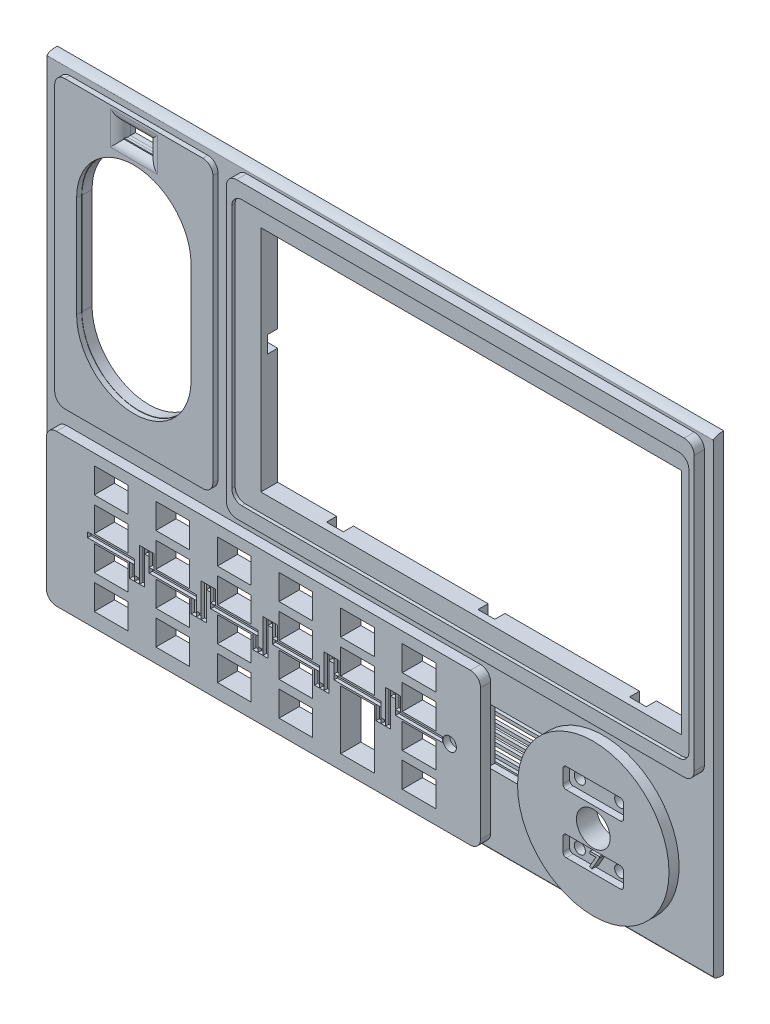
from build123d import *

# Parameters (mm, degrees)
SKETCH1_W                   = 198
SKETCH1_H                   = 140
MAIN_BODY_DEPTH             = 3
LONG_CORNERS_SIZE           = 3
LONG_CORNERS_SIZE_2         = 1
SKETCH2_W                   = 47
SKETCH2_H                   = 85
SPEAKER_DEPTH               = 1.5
SPEAKER_CORNERS_R           = 3
SPEAKER_CUT_DEPTH           = 122.331158548
SKETCH21_W                  = 43
SKETCH21_H                  = 72
SPEAKER_SLOT_DEPTH          = 3
SKETCH36_W                  = 43
SKETCH36_H                  = 0.5
SKETCH36_W_2                = 5.5
SKETCH36_W_3                = 3.5
SKETCH36_W_4                = 10
SPEAKER_PRINT_SUPPORT_DEPTH = 3
SKETCH3_W                   = 139
SKETCH3_H                   = 87.25
LCD_DEPTH                   = 3
LCD_CORNERS_R               = 3
SKETCH9_W                   = 135.8
SKETCH9_H                   = 78.75
LCD_FRONT_DEPTH             = 1
LCD_FRONT_CORNERS_R         = 3
SKETCH10_W                  = 125
SKETCH10_H                  = 68
LCD_BACK_DEPTH              = 122.396046203
SKETCH56_W                  = 5
SKETCH56_H                  = 3
SKETCH56_W_2                = 3
SKETCH56_H_2                = 5
LCD_GLUE_POINTS_DEPTH       = 3
SKETCH4_W                   = 129
SKETCH4_H                   = 45
KEYPAD_DEPTH                = 3
KEYPAD_CORNERS_R            = 3
SKETCH25_W                  = 10
SKETCH25_H                  = 7.5
SKETCH25_H_2                = 17.5
KEYPAD_CUTS_0_8_DEPTH       = 122.396046208
SKETCH5_R                   = 22.5
VFO_DEPTH                   = 3
SKETCH7_R                   = 5
VFO_ENCODER_KNOB_CUT_DEPTH  = 122.396046208
SKETCH37_W                  = 18
SKETCH37_H                  = 6
LOGO_CUT_DEPTH              = 2
SKETCH44_R                  = 1.65
ENCODER_MOUNT_HOLES_DEPTH   = 122.396046208
ENC_CUT_CORNERS_R           = 1
LOGO_TXT_VER_DEPTH          = 2
ESP32_W                     = 18.5
ESP32_H                     = 16.5
ESP32_CAN_CUT_DEPTH         = 3
SKETCH43_W                  = 17.5
SKETCH43_H                  = 17.5
LORA_CUT_DEPTH              = 2.5
SKETCH47_W                  = 27
SKETCH47_H                  = 18.5
ESP32_EX_CUT_DEPTH          = 1
SKETCH49_W                  = 8
SKETCH49_H                  = 4
AMB_SENSOR_DEPTH            = 122.396046203
AMB_CORNERS_R               = 3
SKETCH50_W                  = 14
SKETCH50_H                  = 1.5
SKETCH50_W_2                = 1.5
SKETCH50_H_2                = 4.24
SKETCH50_H_3                = 10
SKETCH50_W_3                = 1.3
SKETCH50_W_4                = 1.45
SKETCH50_W_5                = 1.26
SKETCH50_W_6                = 1.46
LORA_ANT_DEPTH              = 1
SKETCH51_R                  = 0.5
LORA_ANT_PIN_DEPTH          = 122.396046208
SKETCH52_R                  = 2
LORA_ANT_SOLDER_DEPTH       = 2
SKETCH53_W                  = 26.5
SKETCH53_H                  = 1
ESP32_SUPPORT_DEPTH         = 1
SKETCH54_W                  = 17.5
SKETCH54_H                  = 0.8
LORA_SUPPORTS_DEPTH         = 2.5
SKETCH55_W                  = 10
SKETCH55_H                  = 20
SKETCH55_W_2                = 22
SKETCH55_H_2                = 4
SKETCH55_W_3                = 4
SKETCH55_H_3                = 10
SKETCH55_W_4                = 3
SKETCH55_H_4                = 5
SKETCH55_W_5                = 14
SKETCH55_W_6                = 13
SKETCH55_H_5                = 3
SKETCH55_W_7                = 15
SKETCH55_H_6                = 6
CONN_CUTOUTS_DEPTH          = 2


with BuildPart() as part:
    # Sketch1 → main_body (new body)
    with BuildSketch(Plane.XY):
        Rectangle(SKETCH1_W, SKETCH1_H)
    extrude(amount=MAIN_BODY_DEPTH)

    # long_corners
    # an asymmetric fillet: 3, 1 mm, written as the material it takes off along each edge
    with BuildSketch(Plane(origin=(-106.5, 70, 3), x_dir=(0, 0, -1), z_dir=(1, 0, 0)), Plane(origin=(106.5, -70, 3), x_dir=(0, 0, -1), z_dir=(-1, 0, 0))) as long_corners_piece_1:
        with BuildLine():
            Bezier((LONG_CORNERS_SIZE, 0), (0, 0), (0, -LONG_CORNERS_SIZE_2), weights=[1, 0.707106781, 1])
            Line((0, -LONG_CORNERS_SIZE_2), (0, 0))
            Line((0, 0), (LONG_CORNERS_SIZE, 0))
        make_face()
    extrude(amount=213, mode=Mode.SUBTRACT)

    # Sketch2 → speaker (add)
    with BuildSketch(Plane.XY.offset(3)):
        with Locations((-71.75, 24.75)):
            Rectangle(SKETCH2_W, SKETCH2_H)
    extrude(amount=SPEAKER_DEPTH)

    # speaker_corners
    speaker_corners_edges = [part.edges().sort_by_distance(p)[0] for p in [
        (-95.25, 67.25, 3.75),
        (-95.25, -17.75, 3.75),
        (-48.25, -17.75, 3.75),
        (-48.25, 67.25, 3.75),
    ]]
    fillet(speaker_corners_edges, radius=SPEAKER_CORNERS_R)

    # Sketch19 → speaker_cut (cut, through all)
    with BuildSketch(Plane.XY.offset(4.5)):
        with BuildLine():
            Line((-88.75, 8.25), (-88.75, 38.25))
            ThreePointArc((-88.75, 38.25), (-71.75, 55.25), (-54.75, 38.25))
            Line((-54.75, 38.25), (-54.75, 8.25))
            ThreePointArc((-54.75, 8.25), (-71.75, -8.75), (-88.75, 8.25))
        make_face()
    extrude(amount=-SPEAKER_CUT_DEPTH, mode=Mode.SUBTRACT)

    # Sketch21 → speaker_slot (cut)
    with BuildSketch(Plane(origin=(0, 0, 0), x_dir=(-1, 0, 0), z_dir=(0, 0, -1))):
        with Locations((71.75, 23.25)):
            Rectangle(SKETCH21_W, SKETCH21_H)
    extrude(amount=-SPEAKER_SLOT_DEPTH, mode=Mode.SUBTRACT)

    # Sketch36 → speaker_print_support (add)
    # profile 1 of 17: a face of its own
    with BuildSketch(Plane(origin=(0, 0, 3), x_dir=(-1, 0, 0), z_dir=(0, 0, -1))):
        with BuildLine():
            Line((54.25, 8.263862744), (54.25, 38.236137256))
            ThreePointArc((54.25, 38.236137256), (71.75, 55.736137256), (89.25, 38.236137256))
            Line((89.25, 38.236137256), (89.25, 8.263862744))
            ThreePointArc((89.25, 8.263862744), (71.75, -9.236137256), (54.25, 8.263862744))
        make_face()
        with BuildLine():
            Line((54.831583339, 8.263862744), (54.831583339, 38.236137256))
            ThreePointArc((54.831583339, 38.236137256), (71.75, 55.154553916), (88.668416661, 38.236137256))
            Line((88.668416661, 38.236137256), (88.668416661, 8.263862744))
            ThreePointArc((88.668416661, 8.263862744), (71.75, -8.654553916), (54.831583339, 8.263862744))
        make_face(mode=Mode.SUBTRACT)
    # profile 2 of 17: a face of its own
    with BuildSketch(Plane(origin=(0, 0, 3), x_dir=(-1, 0, 0), z_dir=(0, 0, -1))):
        with Locations((71.75, 57)):
            Rectangle(SKETCH36_W, SKETCH36_H)
    # profile 3 of 17: a face of its own
    with BuildSketch(Plane(origin=(0, 0, 3), x_dir=(-1, 0, 0), z_dir=(0, 0, -1))):
        with Locations((90.5, 0)):
            Rectangle(SKETCH36_W_2, SKETCH36_H)
    # profile 4 of 17: a face of its own
    with BuildSketch(Plane(origin=(0, 0, 3), x_dir=(-1, 0, 0), z_dir=(0, 0, -1))):
        with Locations((71.75, -10.5)):
            Rectangle(SKETCH36_W, SKETCH36_H)
    # profile 5 of 17: a face of its own
    with BuildSketch(Plane(origin=(0, 0, 3), x_dir=(-1, 0, 0), z_dir=(0, 0, -1))):
        with Locations((90.5, 46.5)):
            Rectangle(SKETCH36_W_2, SKETCH36_H)
    # profile 6 of 17: a face of its own
    with BuildSketch(Plane(origin=(0, 0, 3), x_dir=(-1, 0, 0), z_dir=(0, 0, -1))):
        with Locations((91.5, 35)):
            Rectangle(SKETCH36_W_3, SKETCH36_H)
    # profile 7 of 17: a face of its own
    with BuildSketch(Plane(origin=(0, 0, 3), x_dir=(-1, 0, 0), z_dir=(0, 0, -1))):
        with Locations((91.5, 23.5)):
            Rectangle(SKETCH36_W_3, SKETCH36_H)
    # profile 8 of 17: a face of its own
    with BuildSketch(Plane(origin=(0, 0, 3), x_dir=(-1, 0, 0), z_dir=(0, 0, -1))):
        with Locations((91.5, 11)):
            Rectangle(SKETCH36_W_3, SKETCH36_H)
    # profile 9 of 17: a face of its own
    with BuildSketch(Plane(origin=(0, 0, 3), x_dir=(-1, 0, 0), z_dir=(0, 0, -1))):
        with Locations((88.25, -5.5)):
            Rectangle(SKETCH36_W_4, SKETCH36_H)
    # profile 10 of 17: a face of its own
    with BuildSketch(Plane(origin=(0, 0, 3), x_dir=(-1, 0, 0), z_dir=(0, 0, -1))):
        with Locations((88.25, 52)):
            Rectangle(SKETCH36_W_4, SKETCH36_H)
    # profile 11 of 17: a face of its own
    with BuildSketch(Plane(origin=(0, 0, 3), x_dir=(-1, 0, 0), z_dir=(0, 0, -1))):
        with Locations((55.25, 52)):
            Rectangle(SKETCH36_W_4, SKETCH36_H)
    # profile 12 of 17: a face of its own
    with BuildSketch(Plane(origin=(0, 0, 3), x_dir=(-1, 0, 0), z_dir=(0, 0, -1))):
        with Locations((53, 46.5)):
            Rectangle(SKETCH36_W_2, SKETCH36_H)
    # profile 13 of 17: a face of its own
    with BuildSketch(Plane(origin=(0, 0, 3), x_dir=(-1, 0, 0), z_dir=(0, 0, -1))):
        with Locations((52, 35)):
            Rectangle(SKETCH36_W_3, SKETCH36_H)
    # profile 14 of 17: a face of its own
    with BuildSketch(Plane(origin=(0, 0, 3), x_dir=(-1, 0, 0), z_dir=(0, 0, -1))):
        with Locations((52, 23.5)):
            Rectangle(SKETCH36_W_3, SKETCH36_H)
    # profile 15 of 17: a face of its own
    with BuildSketch(Plane(origin=(0, 0, 3), x_dir=(-1, 0, 0), z_dir=(0, 0, -1))):
        with Locations((52, 10.5)):
            Rectangle(SKETCH36_W_3, SKETCH36_H)
    # profile 16 of 17: a face of its own
    with BuildSketch(Plane(origin=(0, 0, 3), x_dir=(-1, 0, 0), z_dir=(0, 0, -1))):
        with Locations((53, 0)):
            Rectangle(SKETCH36_W_2, SKETCH36_H)
    # profile 17 of 17: a face of its own
    with BuildSketch(Plane(origin=(0, 0, 3), x_dir=(-1, 0, 0), z_dir=(0, 0, -1))):
        with Locations((55.25, -5.5)):
            Rectangle(SKETCH36_W_4, SKETCH36_H)
    extrude(amount=SPEAKER_PRINT_SUPPORT_DEPTH)

    # Sketch3 → lcd (add)
    with BuildSketch(Plane.XY.offset(3)):
        with Locations((26.75, 24.625)):
            Rectangle(SKETCH3_W, SKETCH3_H)
    extrude(amount=LCD_DEPTH)

    # lcd_corners
    lcd_corners_edges = [part.edges().sort_by_distance(p)[0] for p in [
        (-42.75, 68.25, 4.5),
        (-42.75, -19, 4.5),
        (96.25, -19, 4.5),
        (96.25, 68.25, 4.5),
    ]]
    fillet(lcd_corners_edges, radius=LCD_CORNERS_R)

    # Sketch9 → lcd_front (cut)
    with BuildSketch(Plane.XY.offset(6)):
        with Locations((26.75, 24.5)):
            Rectangle(SKETCH9_W, SKETCH9_H)
    extrude(amount=-LCD_FRONT_DEPTH, mode=Mode.SUBTRACT)

    # lcd_front_corners
    lcd_front_corners_edges = [part.edges().sort_by_distance(p)[0] for p in [
        (-41.15, -14.875, 5.5),
        (-41.15, 63.875, 5.5),
        (94.65, 63.875, 5.5),
        (94.65, -14.875, 5.5),
    ]]
    fillet(lcd_front_corners_edges, radius=LCD_FRONT_CORNERS_R)

    # Sketch10 → lcd_back (cut, through all)
    with BuildSketch(Plane(origin=(0, 0, 0), x_dir=(-1, 0, 0), z_dir=(0, 0, -1))):
        with Locations((-29, 24.5)):
            Rectangle(SKETCH10_W, SKETCH10_H)
    extrude(amount=-LCD_BACK_DEPTH, mode=Mode.SUBTRACT)

    # Sketch56 → lcd_glue_points (cut)
    with BuildSketch(Plane(origin=(0, 0, 0), x_dir=(-1, 0, 0), z_dir=(0, 0, -1))):
        with Locations((-76.5, -11)):
            Rectangle(SKETCH56_W, SKETCH56_H)
        with Locations((-31.5, -11)):
            Rectangle(SKETCH56_W, SKETCH56_H)
        with Locations((13.5, -11)):
            Rectangle(SKETCH56_W, SKETCH56_H)
        with Locations((-76.5, 60)):
            Rectangle(SKETCH56_W, SKETCH56_H)
        with Locations((-31.5, 60)):
            Rectangle(SKETCH56_W, SKETCH56_H)
        with Locations((13.5, 60)):
            Rectangle(SKETCH56_W, SKETCH56_H)
        with Locations((35, 27.5)):
            Rectangle(SKETCH56_W_2, SKETCH56_H_2)
    extrude(amount=-LCD_GLUE_POINTS_DEPTH, mode=Mode.SUBTRACT)

    # Sketch4 → keypad (add)
    with BuildSketch(Plane.XY.offset(3)):
        with Locations((-31.75, -45.75)):
            Rectangle(SKETCH4_W, SKETCH4_H)
    extrude(amount=KEYPAD_DEPTH)

    # keypad_corners
    keypad_corners_edges = [part.edges().sort_by_distance(p)[0] for p in [
        (-96.25, -23.25, 4.5),
        (-96.25, -68.25, 4.5),
        (32.75, -68.25, 4.5),
        (32.75, -23.25, 4.5),
    ]]
    fillet(keypad_corners_edges, radius=KEYPAD_CORNERS_R)

    # Sketch25 → keypad_cuts_0.8 (cut, through all)
    with BuildSketch(Plane.XY.offset(6)):
        with Locations((-77, -30.25)):
            Rectangle(SKETCH25_W, SKETCH25_H)
        with Locations((-77, -40.25)):
            Rectangle(SKETCH25_W, SKETCH25_H)
        with Locations((-77, -50.25)):
            Rectangle(SKETCH25_W, SKETCH25_H)
        with Locations((-77, -60.25)):
            Rectangle(SKETCH25_W, SKETCH25_H)
        with Locations((-58.7, -30.25)):
            Rectangle(SKETCH25_W, SKETCH25_H)
        with Locations((-58.7, -40.25)):
            Rectangle(SKETCH25_W, SKETCH25_H)
        with Locations((-58.7, -50.25)):
            Rectangle(SKETCH25_W, SKETCH25_H)
        with Locations((-58.7, -60.25)):
            Rectangle(SKETCH25_W, SKETCH25_H)
        with Locations((-40.4, -30.25)):
            Rectangle(SKETCH25_W, SKETCH25_H)
        with Locations((-40.4, -40.25)):
            Rectangle(SKETCH25_W, SKETCH25_H)
        with Locations((-40.4, -50.25)):
            Rectangle(SKETCH25_W, SKETCH25_H)
        with Locations((-40.4, -60.25)):
            Rectangle(SKETCH25_W, SKETCH25_H)
        with Locations((-22.1, -30.25)):
            Rectangle(SKETCH25_W, SKETCH25_H)
        with Locations((-22.1, -40.25)):
            Rectangle(SKETCH25_W, SKETCH25_H)
        with Locations((-22.1, -50.25)):
            Rectangle(SKETCH25_W, SKETCH25_H)
        with Locations((-22.1, -60.25)):
            Rectangle(SKETCH25_W, SKETCH25_H)
        with Locations((-3.8, -30.25)):
            Rectangle(SKETCH25_W, SKETCH25_H)
        with Locations((14.5, -30.25)):
            Rectangle(SKETCH25_W, SKETCH25_H)
        with Locations((-3.8, -40.25)):
            Rectangle(SKETCH25_W, SKETCH25_H)
        with Locations((14.5, -40.25)):
            Rectangle(SKETCH25_W, SKETCH25_H)
        with Locations((14.5, -50.25)):
            Rectangle(SKETCH25_W, SKETCH25_H)
        with Locations((14.5, -60.25)):
            Rectangle(SKETCH25_W, SKETCH25_H)
        with Locations((-3.8, -55.25)):
            Rectangle(SKETCH25_W, SKETCH25_H_2)
    extrude(amount=-KEYPAD_CUTS_0_8_DEPTH, mode=Mode.SUBTRACT)

    # Sketch5 → vfo (add)
    with BuildSketch(Plane.XY.offset(3)):
        with Locations((66.25, -45.75)):
            Circle(SKETCH5_R)
    extrude(amount=VFO_DEPTH)

    # Sketch7 → vfo_encoder_knob_cut (cut, through all)
    with BuildSketch(Plane.XY.offset(6)):
        with Locations((66.25, -45.75)):
            Circle(SKETCH7_R)
    extrude(amount=-VFO_ENCODER_KNOB_CUT_DEPTH, mode=Mode.SUBTRACT)

    # Sketch37 → logo_cut (cut)
    with BuildSketch(Plane.XY.offset(6)):
        with Locations((66.25, -54.25)):
            Rectangle(SKETCH37_W, SKETCH37_H)
        with Locations((66.25, -36.75)):
            Rectangle(SKETCH37_W, SKETCH37_H)
    extrude(amount=-LOGO_CUT_DEPTH, mode=Mode.SUBTRACT)

    # Sketch44 → encoder_mount_holes (cut, through all)
    with BuildSketch(Plane.XY.offset(6)):
        with Locations((60.25, -36.75)):
            Circle(SKETCH44_R)
        with Locations((72.25, -36.75)):
            Circle(SKETCH44_R)
        with Locations((60.25, -54.75)):
            Circle(SKETCH44_R)
        with Locations((72.25, -54.75)):
            Circle(SKETCH44_R)
    extrude(amount=-ENCODER_MOUNT_HOLES_DEPTH, mode=Mode.SUBTRACT)

    # enc_cut_corners
    enc_cut_corners_edges = [part.edges().sort_by_distance(p)[0] for p in [
        (57.25, -57.25, 5),
        (57.25, -51.25, 5),
        (75.25, -51.25, 5),
        (75.25, -57.25, 5),
        (57.25, -39.75, 5),
        (57.25, -33.75, 5),
        (75.25, -33.75, 5),
        (75.25, -39.75, 5),
    ]]
    fillet(enc_cut_corners_edges, radius=ENC_CUT_CORNERS_R)

    # Sketch39 → logo_txt_ver (add)
    with BuildSketch(Plane.XY.offset(4)):
        Polygon((65.347008547, -52.016666667), (68.060683761, -52.016666667), (68.006410256, -52.514456464), (65.815965545, -56.358547009), (65.166379541, -55.978632479), (67.021854968, -52.722222222), (65.292735043, -52.722222222), align=None)
    extrude(amount=LOGO_TXT_VER_DEPTH)

    # esp32 → esp32_can_cut (cut)
    with BuildSketch(Plane(origin=(0, 0, 0), x_dir=(-1, 0, 0), z_dir=(0, 0, -1))):
        with Locations((-41.25, -40.3)):
            Rectangle(ESP32_W, ESP32_H)
    extrude(amount=-ESP32_CAN_CUT_DEPTH, mode=Mode.SUBTRACT)

    # Sketch43 → lora_cut (cut)
    with BuildSketch(Plane(origin=(0, 0, 0), x_dir=(-1, 0, 0), z_dir=(0, 0, -1))):
        with Locations((-32.25, -59.25)):
            Rectangle(SKETCH43_W, SKETCH43_H)
    extrude(amount=-LORA_CUT_DEPTH, mode=Mode.SUBTRACT)

    # Sketch47 → esp32_ex_cut (cut)
    with BuildSketch(Plane(origin=(0, 0, 0), x_dir=(-1, 0, 0), z_dir=(0, 0, -1))):
        with Locations((-44.5, -40.3)):
            Rectangle(SKETCH47_W, SKETCH47_H)
    extrude(amount=-ESP32_EX_CUT_DEPTH, mode=Mode.SUBTRACT)

    # Sketch49 → amb_sensor (cut, through all)
    with BuildSketch(Plane(origin=(0, 0, 0), x_dir=(-1, 0, 0), z_dir=(0, 0, -1))):
        with Locations((71.75, 61.35)):
            Rectangle(SKETCH49_W, SKETCH49_H)
    extrude(amount=-AMB_SENSOR_DEPTH, mode=Mode.SUBTRACT)

    # amb_corners
    amb_corners_edges = [part.edges().sort_by_distance(p)[0] for p in [
        (-71.75, 59.35, 4.5),
        (-75.75, 61.35, 4.5),
        (-71.75, 63.35, 4.5),
        (-67.75, 61.35, 4.5),
    ]]
    fillet(amb_corners_edges, radius=AMB_CORNERS_R)

    # Sketch50 → lora_ant (cut)
    with BuildSketch(Plane.XY.offset(6)):
        with Locations((-77, -45.25)):
            Rectangle(SKETCH50_W, SKETCH50_H)
        with Locations((-58.7, -45.25)):
            Rectangle(SKETCH50_W, SKETCH50_H)
        with Locations((-40.4, -45.25)):
            Rectangle(SKETCH50_W, SKETCH50_H)
        with Locations((-22.1, -45.25)):
            Rectangle(SKETCH50_W, SKETCH50_H)
        with Locations((-3.8, -45.25)):
            Rectangle(SKETCH50_W, SKETCH50_H)
        with Locations((14.5, -45.25)):
            Rectangle(SKETCH50_W, SKETCH50_H)
        with Locations((8.24, -42.37)):
            Rectangle(SKETCH50_W_2, SKETCH50_H_2)
        with Locations((2.45, -48.13)):
            Rectangle(SKETCH50_W_2, SKETCH50_H_2)
        with Locations((5.27, -45.25)):
            Rectangle(SKETCH50_W_2, SKETCH50_H_3)
        with Locations((3.86, -49.5)):
            Rectangle(SKETCH50_W_3, SKETCH50_H)
        with Locations((6.755, -41)):
            Rectangle(SKETCH50_W_4, SKETCH50_H)
        with Locations((-13.03, -45.25)):
            Rectangle(SKETCH50_W_2, SKETCH50_H_3)
        with Locations((-31.13, -45.25)):
            Rectangle(SKETCH50_W_2, SKETCH50_H_3)
        with Locations((-49.48, -45.25)):
            Rectangle(SKETCH50_W_2, SKETCH50_H_3)
        with Locations((-67.78, -45.25)):
            Rectangle(SKETCH50_W_2, SKETCH50_H_3)
        with Locations((-70.75, -48.13)):
            Rectangle(SKETCH50_W_2, SKETCH50_H_2)
        with Locations((-69.265, -49.5)):
            Rectangle(SKETCH50_W_4, SKETCH50_H)
        with Locations((-66.37, -41)):
            Rectangle(SKETCH50_W_3, SKETCH50_H)
        with Locations((-64.96, -42.37)):
            Rectangle(SKETCH50_W_2, SKETCH50_H_2)
        with Locations((-52.45, -48.13)):
            Rectangle(SKETCH50_W_2, SKETCH50_H_2)
        with Locations((-50.965, -49.5)):
            Rectangle(SKETCH50_W_4, SKETCH50_H)
        with Locations((-48.07, -41)):
            Rectangle(SKETCH50_W_3, SKETCH50_H)
        with Locations((-46.66, -42.37)):
            Rectangle(SKETCH50_W_2, SKETCH50_H_2)
        with Locations((-34.15, -48.13)):
            Rectangle(SKETCH50_W_2, SKETCH50_H_2)
        with Locations((-32.64, -49.5)):
            Rectangle(SKETCH50_W_2, SKETCH50_H)
        with Locations((-29.74, -41)):
            Rectangle(SKETCH50_W_5, SKETCH50_H)
        with Locations((-28.35, -42.37)):
            Rectangle(SKETCH50_W_2, SKETCH50_H_2)
        with Locations((-15.85, -48.13)):
            Rectangle(SKETCH50_W_2, SKETCH50_H_2)
        with Locations((-14.44, -49.5)):
            Rectangle(SKETCH50_W_3, SKETCH50_H)
        with Locations((-11.54, -41)):
            Rectangle(SKETCH50_W_6, SKETCH50_H)
        with Locations((-10.05, -42.37)):
            Rectangle(SKETCH50_W_2, SKETCH50_H_2)
    extrude(amount=-LORA_ANT_DEPTH, mode=Mode.SUBTRACT)

    # Sketch51 → lora_ant_pin (cut, through all)
    with BuildSketch(Plane.XY.offset(6)):
        with Locations((23.6, -45.25)):
            Circle(SKETCH51_R)
    extrude(amount=-LORA_ANT_PIN_DEPTH, mode=Mode.SUBTRACT)

    # Sketch52 → lora_ant_solder (cut)
    with BuildSketch(Plane.XY.offset(6)):
        with Locations((23.6, -45.25)):
            Circle(SKETCH52_R)
    extrude(amount=-LORA_ANT_SOLDER_DEPTH, mode=Mode.SUBTRACT)

    # Sketch53 → esp32_support (add)
    with BuildSketch(Plane(origin=(0, 0, 1), x_dir=(-1, 0, 0), z_dir=(0, 0, -1))):
        with Locations((-44.581142086, -32.05)):
            Rectangle(SKETCH53_W, SKETCH53_H)
        with Locations((-44.581142086, -35.55)):
            Rectangle(SKETCH53_W, SKETCH53_H)
        with Locations((-44.581142086, -38.55)):
            Rectangle(SKETCH53_W, SKETCH53_H)
        with Locations((-44.581142086, -41.05)):
            Rectangle(SKETCH53_W, SKETCH53_H)
        with Locations((-44.581142086, -43.55)):
            Rectangle(SKETCH53_W, SKETCH53_H)
        with Locations((-44.581142086, -46.55)):
            Rectangle(SKETCH53_W, SKETCH53_H)
        with Locations((-44.581142086, -48.55)):
            Rectangle(SKETCH53_W, SKETCH53_H)
    extrude(amount=ESP32_SUPPORT_DEPTH)

    # Sketch54 → lora_supports (add)
    with BuildSketch(Plane(origin=(0, 0, 2.5), x_dir=(-1, 0, 0), z_dir=(0, 0, -1))):
        with Locations((-32.25, -53.4)):
            Rectangle(SKETCH54_W, SKETCH54_H)
        with Locations((-32.25, -59)):
            Rectangle(SKETCH54_W, SKETCH54_H)
        with Locations((-32.25, -64.6)):
            Rectangle(SKETCH54_W, SKETCH54_H)
        with Locations((-32.25, -56.2)):
            Rectangle(SKETCH54_W, SKETCH54_H)
        with Locations((-32.25, -61.8)):
            Rectangle(SKETCH54_W, SKETCH54_H)
    extrude(amount=LORA_SUPPORTS_DEPTH)

    # Sketch55 → conn_cutouts (cut)
    with BuildSketch(Plane(origin=(0, 0, 0), x_dir=(-1, 0, 0), z_dir=(0, 0, -1))):
        with Locations((-89, -25)):
            Rectangle(SKETCH55_W, SKETCH55_H)
        with Locations((-68, 67)):
            Rectangle(SKETCH55_W_2, SKETCH55_H_2)
        with Locations((96, 30)):
            Rectangle(SKETCH55_W_3, SKETCH55_H_3)
        with Locations((96.5, 3.5)):
            Rectangle(SKETCH55_W_4, SKETCH55_H_4)
        with Locations((91, -18)):
            Rectangle(SKETCH55_W_5, SKETCH55_H_3)
        with Locations((91.5, -67.5)):
            Rectangle(SKETCH55_W_6, SKETCH55_H_5)
        with Locations((-46.5, -27)):
            Rectangle(SKETCH55_W_7, SKETCH55_H_6)
        with Locations((96.5, -11)):
            Rectangle(SKETCH55_W_4, SKETCH55_H_5)
    extrude(amount=-CONN_CUTOUTS_DEPTH, mode=Mode.SUBTRACT)


solid = part.part
